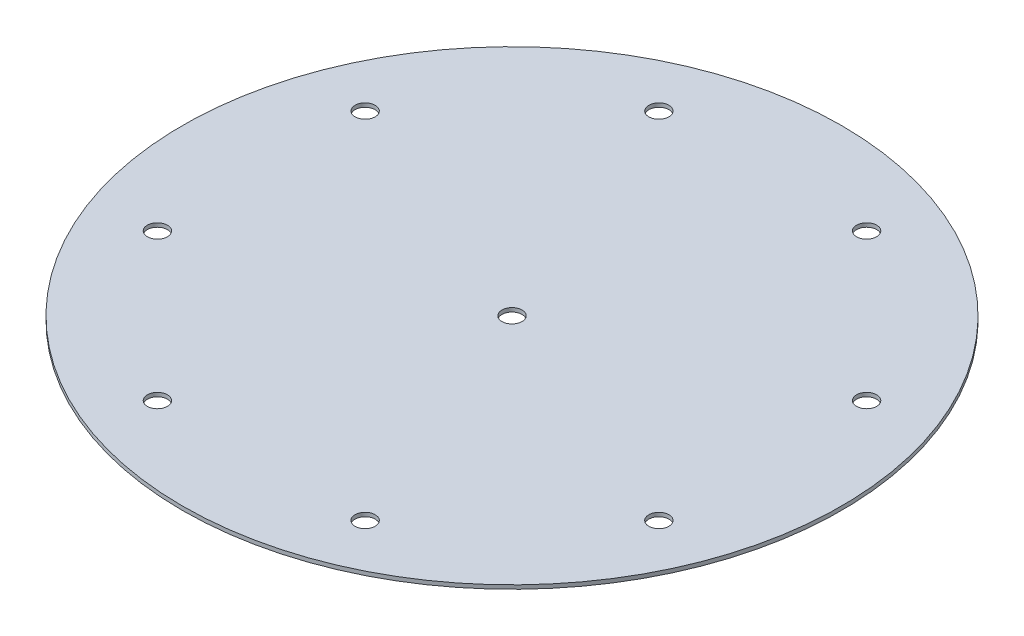
from build123d import *

# Parameters (mm, degrees)
SKETCH2_W                  = 84.99983
SKETCH2_H                  = 1
F_6_0_204_DIAMETER_HOLE1_D = 5.1816
CIRPATTERN3_COUNT          = 8
F_6_0_204_DIAMETER_HOLE2_D = 5.1816


with BuildPart() as part:
    # Sketch2 → Revolve1 (revolve)
    with BuildSketch(Plane(origin=(0, 0, 0), x_dir=(0, 0, -1), z_dir=(1, 0, 0))):
        with Locations((-42.499915, 0.5)):
            Rectangle(SKETCH2_W, SKETCH2_H)
    revolve(axis=Axis((0, -0.75, 0), (0, 1, 0)))

    # #6 (0.204) Diameter Hole1 (through all)
    with Locations(Plane(origin=(0, 1, 0), x_dir=(1, 0, 0), z_dir=(0, 1, 0))):
        with Locations((-26.787840266, 64.671567276)):
            f_6_0_204_diameter_hole1 = Hole(F_6_0_204_DIAMETER_HOLE1_D / 2)

    # CirPattern3: #6 (0.204) Diameter Hole1 ×8 about axis
    cirpattern3_axis = Axis((0, -0.75, 0), (0, 1, 0))
    for i in range(1, CIRPATTERN3_COUNT):
        add(f_6_0_204_diameter_hole1.rotate(cirpattern3_axis, i * 360 / CIRPATTERN3_COUNT), mode=Mode.SUBTRACT)

    # #6 (0.204) Diameter Hole2 (through all)
    with Locations(Plane(origin=(0, 1, 0), x_dir=(1, 0, 0), z_dir=(0, 1, 0))):
        with Locations((0, 0)):
            Hole(F_6_0_204_DIAMETER_HOLE2_D / 2)


solid = part.part
